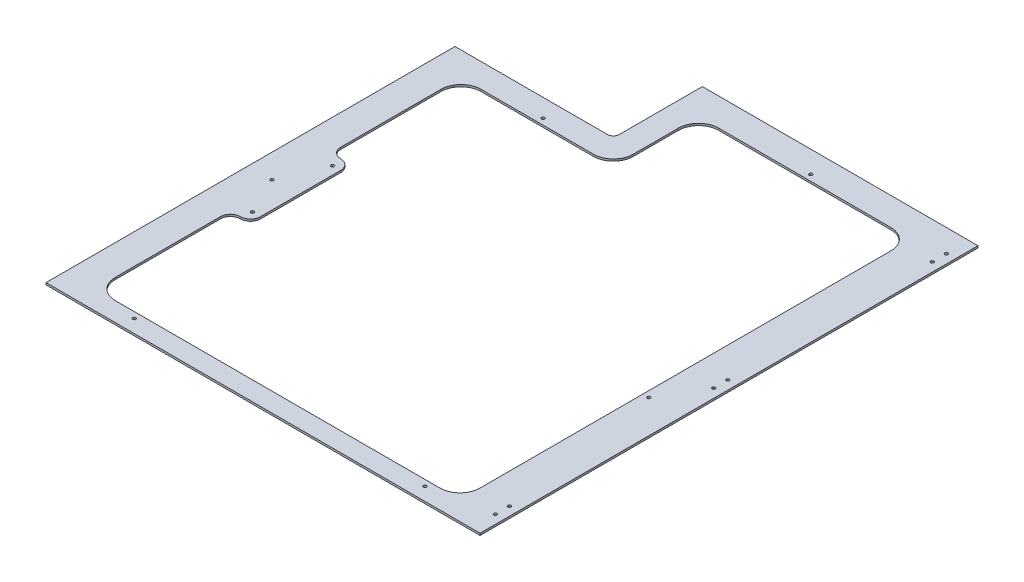
from build123d import *

# Parameters (mm, degrees)
CROQUIS1_W              = 434
CROQUIS1_H              = 500
SALIENTE_EXTRUIR1_DEPTH = 2
CROQUIS3_W              = 157
CROQUIS3_H              = 90
CORTAR_EXTRUIR2_DEPTH   = 2
REDONDEO1_R             = 5
CORTAR_EXTRUIR3_DEPTH   = 2
REDONDEO2_R             = 20
CROQUIS6_R              = 1.55
CORTAR_EXTRUIR5_DEPTH   = 2
CROQUIS7_R              = 1.55
CORTAR_EXTRUIR6_DEPTH   = 2
CROQUIS8_W              = 20
CROQUIS8_H              = 100
SALIENTE_EXTRUIR2_DEPTH = 2
REDONDEO3_R             = 10
CROQUIS9_R              = 1.55
CORTAR_EXTRUIR7_DEPTH   = 2
CROQUIS10_OUTSIDE_W     = 568.418
CROQUIS10_OUTSIDE_H     = 634.418
CORTAR_EXTRUIR8_DEPTH   = 10
CROQUIS11_W             = 275
CROQUIS11_H             = 1.25
CORTAR_EXTRUIR9_DEPTH   = 2
CROQUIS12_W             = 1
CROQUIS12_H             = 408
SALIENTE_EXTRUIR3_DEPTH = 2


with BuildPart() as part:
    # Croquis1 → Saliente-Extruir1 (new body)
    with BuildSketch(Plane(origin=(0, 0, 0), x_dir=(1, 0, 0), z_dir=(0, 1, 0))):
        with Locations((217, 250)):
            Rectangle(CROQUIS1_W, CROQUIS1_H)
    extrude(amount=SALIENTE_EXTRUIR1_DEPTH)

    # Croquis3 → Cortar-Extruir2 (cut)
    with BuildSketch(Plane.XZ):
        with Locations((78.5, -455)):
            Rectangle(CROQUIS3_W, CROQUIS3_H)
    extrude(amount=-CORTAR_EXTRUIR2_DEPTH, mode=Mode.SUBTRACT)

    # Redondeo1
    redondeo1_edges = [part.edges().sort_by_distance(p)[0] for p in [
        (157, 1, -410),
    ]]
    fillet(redondeo1_edges, radius=REDONDEO1_R)

    # Croquis4 → Cortar-Extruir3 (cut)
    with BuildSketch(Plane.XZ):
        Polygon((30, -20), (394, -20), (394, -233.661541009), (394, -470), (182, -470), (182, -385), (30, -385), align=None)
    extrude(amount=-CORTAR_EXTRUIR3_DEPTH, mode=Mode.SUBTRACT)

    # Redondeo2
    redondeo2_edges = [part.edges().sort_by_distance(p)[0] for p in [
        (30, 1, -385),
        (30, 1, -20),
        (394, 1, -20),
        (394, 1, -470),
        (182, 1, -470),
        (182, 1, -385),
    ]]
    fillet(redondeo2_edges, radius=REDONDEO2_R)

    # Croquis6 → Cortar-Extruir5 (cut)
    with BuildSketch(Plane.XZ):
        with Locations(Location((75, -14, 0), (0, 0, 270))):
            Circle(CROQUIS6_R)
        with Locations(Location((365, -14, 0), (0, 0, 270))):
            Circle(CROQUIS6_R)
        with Locations(Location((288, -476, 0), (0, 0, 270))):
            Circle(CROQUIS6_R)
        with Locations(Location((106, -391, 0), (0, 0, 270))):
            Circle(CROQUIS6_R)
        with Locations(Location((24, -202.5, 0), (0, 0, 270))):
            Circle(CROQUIS6_R)
        with Locations(Location((400, -202.5, 0), (0, 0, 270))):
            Circle(CROQUIS6_R)
    extrude(amount=-CORTAR_EXTRUIR5_DEPTH, mode=Mode.SUBTRACT)

    # Croquis7 → Cortar-Extruir6 (cut)
    with BuildSketch(Plane.XZ):
        with Locations(Location((424.25, -25, 0), (0, 0, 270))):
            Circle(CROQUIS7_R)
        with Locations(Location((424.25, -39, 0), (0, 0, 270))):
            Circle(CROQUIS7_R)
        with Locations(Location((424.25, -475, 0), (0, 0, 270))):
            Circle(CROQUIS7_R)
        with Locations(Location((424.25, -461, 0), (0, 0, 270))):
            Circle(CROQUIS7_R)
        with Locations(Location((424.25, -243, 0), (0, 0, 270))):
            Circle(CROQUIS7_R)
        with Locations(Location((424.25, -257, 0), (0, 0, 270))):
            Circle(CROQUIS7_R)
    extrude(amount=-CORTAR_EXTRUIR6_DEPTH, mode=Mode.SUBTRACT)

    # Croquis8 → Saliente-Extruir2 (add)
    with BuildSketch(Plane.XZ):
        with Locations((40, -205)):
            Rectangle(CROQUIS8_W, CROQUIS8_H)
    extrude(amount=-SALIENTE_EXTRUIR2_DEPTH)

    # Redondeo3
    redondeo3_edges = [part.edges().sort_by_distance(p)[0] for p in [
        (30, 1, -255),
        (30, 1, -155),
    ]]
    fillet(redondeo3_edges, radius=REDONDEO3_R)
    redondeo3_2_edges = [part.edges().sort_by_distance(p)[0] for p in [
        (50, 1, -255),
        (50, 1, -155),
    ]]
    fillet(redondeo3_2_edges, radius=REDONDEO3_R - 0.0001)  # a hair under: the kernel refuses the full size

    # Croquis9 → Cortar-Extruir7 (cut)
    with BuildSketch(Plane.XZ):
        with Locations(Location((42, -165, 0), (0, 0, 270))):
            Circle(CROQUIS9_R)
        with Locations(Location((42, -245, 0), (0, 0, 270))):
            Circle(CROQUIS9_R)
    extrude(amount=-CORTAR_EXTRUIR7_DEPTH, mode=Mode.SUBTRACT)

    # Croquis10 outside → Cortar-Extruir8 (cut)
    with BuildSketch(Plane.XZ):
        with Locations((217, -250)):
            Rectangle(CROQUIS10_OUTSIDE_W, CROQUIS10_OUTSIDE_H)
        with BuildLine():
            Line((1, -409), (152, -409))
            ThreePointArc((152, -409), (156.242640687, -410.757359313), (158, -415))
            Line((158, -415), (158, -499))
            Line((158, -499), (433, -499))
            Line((433, -499), (433, -1))
            Line((433, -1), (1, -1))
            Line((1, -1), (1, -409))
        make_face(mode=Mode.SUBTRACT)
    extrude(amount=-CORTAR_EXTRUIR8_DEPTH, mode=Mode.SUBTRACT)

    # Croquis11 → Cortar-Extruir9 (cut)
    with BuildSketch(Plane.XZ):
        with Locations((295.5, -498.375)):
            Rectangle(CROQUIS11_W, CROQUIS11_H)
    extrude(amount=-CORTAR_EXTRUIR9_DEPTH, mode=Mode.SUBTRACT)

    # Croquis12 → Saliente-Extruir3 (add)
    with BuildSketch(Plane.XZ):
        with Locations((0.5, -205)):
            Rectangle(CROQUIS12_W, CROQUIS12_H)
    extrude(amount=-SALIENTE_EXTRUIR3_DEPTH)


solid = part.part
